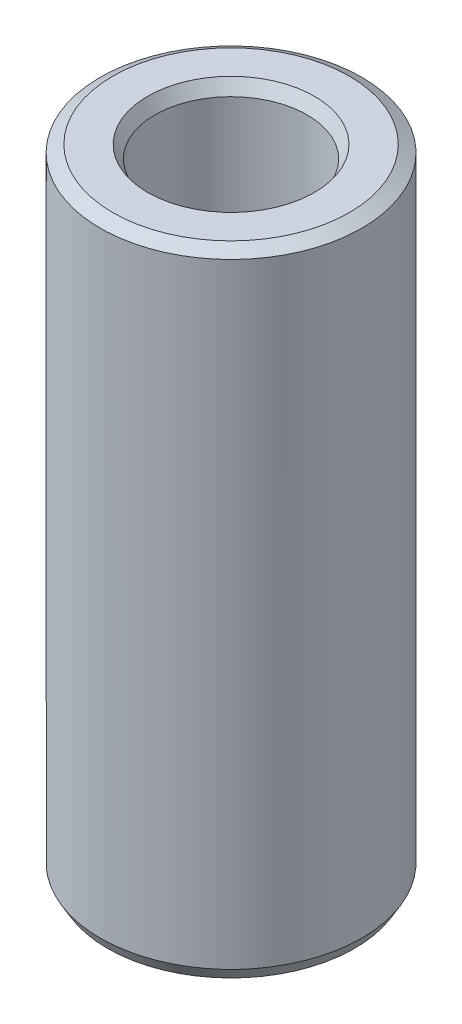
from build123d import *
from OCP.BRepFilletAPI import BRepFilletAPI_MakeChamfer

# Parameters (mm, degrees)
SKETCH1_R           = 55
BOSS_EXTRUDE1_DEPTH = 266.877338345
SKETCH2_R           = 32.030376317
CUT_EXTRUDE1_DEPTH  = 278.981139148
CHAMFER1_SIZE       = 3.044192628
CHAMFER1_SIZE2      = 5.272696299


with BuildPart() as part:
    # Sketch1 → Boss-Extrude1 (new body)
    with BuildSketch(Plane(origin=(0, 0, 0), x_dir=(1, 0, 0), z_dir=(0, 1, 0))):
        Circle(SKETCH1_R)
    extrude(amount=BOSS_EXTRUDE1_DEPTH)

    # Sketch2 → Cut-Extrude1 (cut, through all)
    with BuildSketch(Plane(origin=(0, 0, 0), x_dir=(1, 0, 0), z_dir=(0, 1, 0))):
        Circle(SKETCH2_R)
    extrude(amount=CUT_EXTRUDE1_DEPTH, mode=Mode.SUBTRACT)

    # Chamfer1: one chamfer whose edges measure the first distance from different faces: ONE call of the kernel's chamfer builder (chamfer() names one face for all edges)
    chamfer1_edges_1 = [part.edges().sort_by_distance(p)[0] for p in [
        (-32.030376317, 266.877338345, 0),
    ]]
    chamfer1_side_1 = [part.faces().sort_by_distance(p)[0] for p in [
        (-53.444365081, 266.877338345, 0),
    ]]
    chamfer1_edges_2 = [part.edges().sort_by_distance(p)[0] for p in [
        (-32.030376317, 0, 0),
    ]]
    chamfer1_side_2 = [part.faces().sort_by_distance(p)[0] for p in [
        (-32.030376317, 133.438669173, 0),
    ]]
    chamfer1_edges_3 = [part.edges().sort_by_distance(p)[0] for p in [
        (-55, 0, 0),
    ]]
    chamfer1_side_3 = [part.faces().sort_by_distance(p)[0] for p in [
        (-53.444365081, 0, 0),
    ]]
    chamfer1_edges_4 = [part.edges().sort_by_distance(p)[0] for p in [
        (-55, 266.877338345, 0),
    ]]
    chamfer1_side_4 = [part.faces().sort_by_distance(p)[0] for p in [
        (-55, 133.438669173, 0),
    ]]
    chamfer1 = BRepFilletAPI_MakeChamfer(part.part.solid().wrapped)
    for e in chamfer1_edges_1:
        chamfer1.Add(CHAMFER1_SIZE, CHAMFER1_SIZE2, e.wrapped, chamfer1_side_1[0].wrapped)  # the first distance lies on this face
    for e in chamfer1_edges_2:
        chamfer1.Add(CHAMFER1_SIZE, CHAMFER1_SIZE2, e.wrapped, chamfer1_side_2[0].wrapped)  # the first distance lies on this face
    for e in chamfer1_edges_3:
        chamfer1.Add(CHAMFER1_SIZE, CHAMFER1_SIZE2, e.wrapped, chamfer1_side_3[0].wrapped)  # the first distance lies on this face
    for e in chamfer1_edges_4:
        chamfer1.Add(CHAMFER1_SIZE, CHAMFER1_SIZE2, e.wrapped, chamfer1_side_4[0].wrapped)  # the first distance lies on this face
    add(Compound.cast(chamfer1.Shape()), mode=Mode.REPLACE)


solid = part.part
